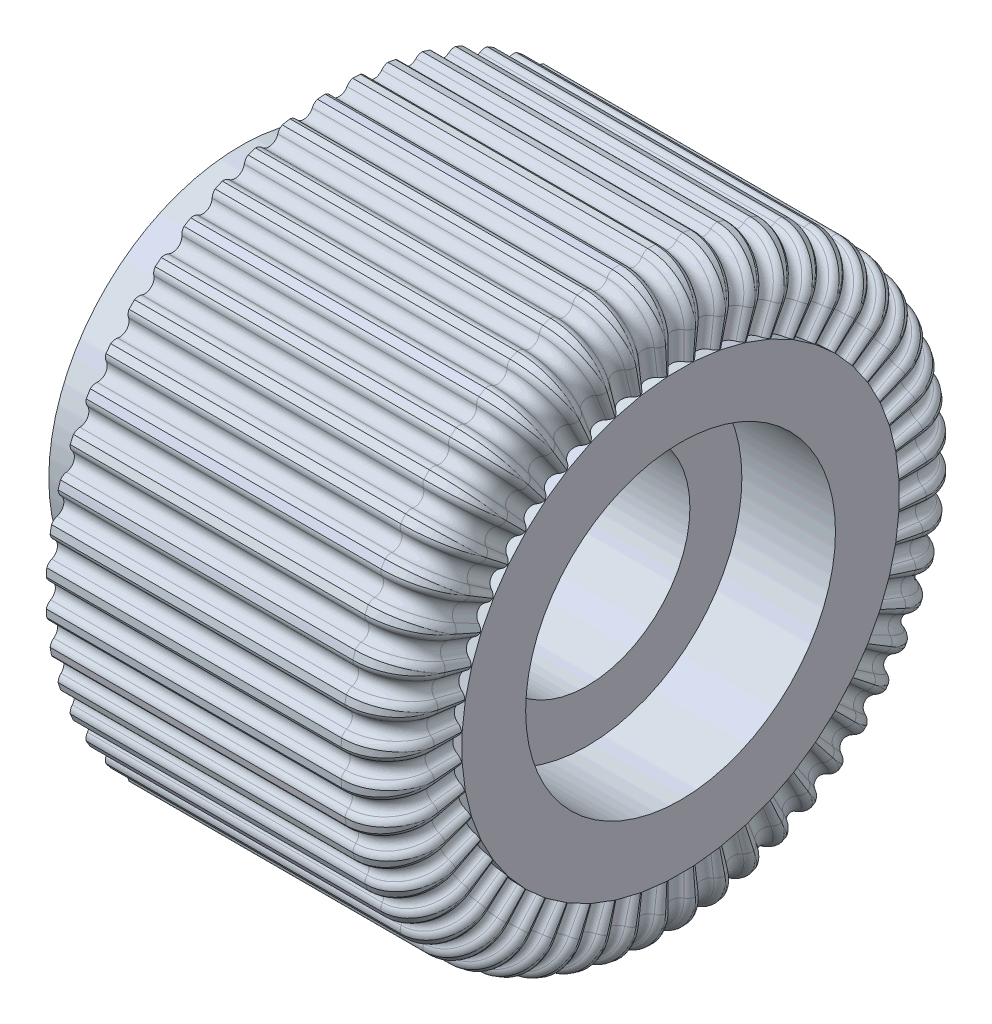
from build123d import *

# Parameters (mm, degrees)
CIRPATTERN1_COUNT = 52
CIRPATTERN1_ANGLE = 353.0730000000008


with BuildPart() as part:
    # Sketch1 → Base-Revolve (revolve)
    with BuildSketch(Plane.XY, mode=Mode.PRIVATE) as base_revolve_sk:
        with BuildLine():
            Line((0, 2.7940000000000005), (0, 5.207))
            Line((0, 5.207), (4.826, 5.207))
            Line((4.826, 5.207), (4.826, 6.3500000000000005))
            Line((4.826, 6.3500000000000005), (2.6669999999999994, 6.35))
            Line((2.6669999999999994, 6.35), (2.6669999999999994, 7.9502))
            Line((2.6669999999999994, 7.9502), (10.667999999999996, 7.950199999999994))
            ThreePointArc((10.667999999999996, 7.950199999999994), (11.56602561210691, 7.578225612106909), (11.937999999999995, 6.680199999999994))
            Line((11.937999999999995, 6.680199999999994), (11.937999999999994, 4.204029943209143))
            Line((11.937999999999994, 4.204029943209143), (9.397999999999993, 4.204029943209144))
            Line((9.397999999999993, 4.204029943209144), (9.397999999999996, 2.793999999999999))
            Line((9.397999999999996, 2.793999999999999), (0, 2.7940000000000005))
        make_face()
    revolve(base_revolve_sk.sketch.rotate(Axis((0, 0, 0), (1, 0, 0)), 90), axis=Axis((0, 0, 0), (1, 0, 0)))

    # Cut-Sweep1: sweep along a path in Sketch3
    with BuildLine(Plane.XY) as cut_sweep1_path:
        Line((11.683999999999994, 5.927252811240181), (11.683999999999996, 6.680199999999994))
        ThreePointArc((11.683999999999996, 6.680199999999994), (11.386420489685529, 7.398620489685526), (10.667999999999996, 7.696199999999994))
        Line((10.667999999999996, 7.696199999999994), (2.6669999999999994, 7.6961999999999975))
    # Sketch4 → Cut-Sweep1 (sweep, cut)
    with BuildSketch(Plane(origin=(11.683999999999994, 5.927252811240181, 0), x_dir=(1, -2.3e-15, 0), z_dir=(-2.3e-15, -1, 0))):
        with BuildLine():
            Line((0.2540000000000008, 0.43994090512249473), (0.2540000000000008, -0.4399409051224945))
            ThreePointArc((0.2540000000000008, -0.4399409051224945), (0.21997045256124798, -0.3129409051224942), (0.127, -0.21997045256124687))
            ThreePointArc((0.127, -0.21997045256124687), (1.1e-16, 2.6e-16), (0.12700000000000053, 0.219970452561247))
            ThreePointArc((0.12700000000000053, 0.219970452561247), (0.2199704525612481, 0.3129409051224946), (0.2540000000000008, 0.43994090512249473))
        make_face()
    cut_sweep1 = sweep(path=cut_sweep1_path.line, mode=Mode.SUBTRACT)

    # CirPattern1: Cut-Sweep1 ×52 about axis
    cirpattern1_axis = Axis((0, -2.6e-16, 9e-17), (1, 0, 0))
    for i in range(1, CIRPATTERN1_COUNT):
        add(cut_sweep1.rotate(cirpattern1_axis, i * CIRPATTERN1_ANGLE / (CIRPATTERN1_COUNT - 1)), mode=Mode.SUBTRACT)


solid = part.part
